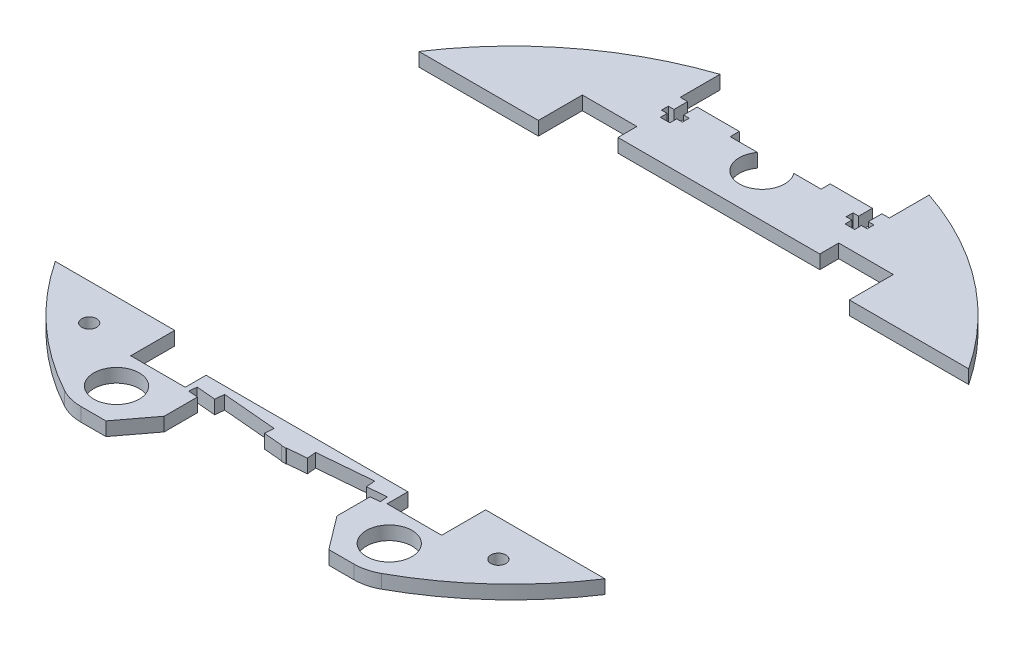
from build123d import *

# Parameters (mm, degrees)
BOSS_EXTRUDE1_DEPTH = 3
CUT_EXTRUDE1_DEPTH  = 103.574363269
SKETCH3_W           = 38.3
SKETCH3_H           = 80
CUT_EXTRUDE2_DEPTH  = 103.574363269
CUT_EXTRUDE3_DEPTH  = 95.453692358
SKETCH5_W           = 38
SKETCH5_H           = 14.605577538
CUT_EXTRUDE4_DEPTH  = 95.453692358
CUT_EXTRUDE5_DEPTH  = 95.453692358
SKETCH7_R           = 5
CUT_EXTRUDE6_DEPTH  = 92.610588908
SKETCH9_W           = 4.6
SKETCH9_H           = 1.5
CUT_EXTRUDE8_DEPTH  = 92.610588908
SKETCH10_W          = 2.1
SKETCH10_H          = 3
SKETCH10_H_2        = 1.5
CUT_EXTRUDE9_DEPTH  = 92.610588908
SKETCH11_R          = 5
CUT_EXTRUDE10_DEPTH = 92.610588908
CUT_EXTRUDE11_DEPTH = 92.610588908
SKETCH14_R          = 1.65
CUT_EXTRUDE12_DEPTH = 92.610588908


with BuildPart() as part:
    # Sketch1 → Boss-Extrude1 (new body)
    with BuildSketch(Plane(origin=(0, 0, 0), x_dir=(1, 0, 0), z_dir=(0, 1, 0))):
        with BuildLine():
            Line((-30.029977361, -64.812867647), (30.029977361, -64.812867647))
            ThreePointArc((30.029977361, -64.812867647), (32.509837414, -64.500503794), (34.834773739, -63.582926471))
            ThreePointArc((34.834773739, -63.582926471), (0, 72.5), (-34.834773739, -63.582926471))
            ThreePointArc((-34.834773739, -63.582926471), (-32.509837414, -64.500503794), (-30.029977361, -64.812867647))
        make_face()
    extrude(amount=BOSS_EXTRUDE1_DEPTH)

    # Sketch2 → Cut-Extrude1 (cut, through all)
    with BuildSketch(Plane(origin=(0, 3, 0), x_dir=(1, 0, 0), z_dir=(0, 1, 0))):
        Polygon((22.2, -45.1), (22.2, -49.675685802), (34.2, -49.675685802), (34.2, 49.675685802), (22.2, 49.675685802), (22.2, 45.5), (-22.2, 45.5), (-22.2, 49.675685802), (-34.2, 49.675685802), (-34.2, -49.675685802), (-22.2, -49.675685802), (-22.2, -45.1), align=None)
    extrude(amount=-CUT_EXTRUDE1_DEPTH, mode=Mode.SUBTRACT)

    # Sketch3 → Cut-Extrude2 (cut, through all)
    with BuildSketch(Plane(origin=(0, 3, 0), x_dir=(1, 0, 0), z_dir=(0, 1, 0))):
        with Locations((-53.35, 0)):
            Rectangle(SKETCH3_W, SKETCH3_H)
        with Locations((53.35, 0)):
            Rectangle(SKETCH3_W, SKETCH3_H)
    extrude(amount=-CUT_EXTRUDE2_DEPTH, mode=Mode.SUBTRACT)


with BuildPart() as cut_extrude2_piece_1:
    # of the separate pieces the step leaves, piece 1, a body of its own (cut_extrude2_pieces)
    add(part.part.solids().sort_by_distance((60.466933112, 0, -40))[0])

    # Sketch6 → Cut-Extrude5 (cut, through all)
    with BuildSketch(Plane(origin=(0, 3, 0), x_dir=(1, 0, 0), z_dir=(0, 1, 0))):
        Polygon((-23, 72.5), (23, 72.5), (23, 60), (10, 60), (10, 58), (-10, 58), (-10, 60), (-23, 60), align=None)
    extrude(amount=-CUT_EXTRUDE5_DEPTH, mode=Mode.SUBTRACT)

    # Sketch9 → Cut-Extrude8 (cut, through all)
    with BuildSketch(Plane(origin=(0, 3, 0), x_dir=(1, 0, 0), z_dir=(0, 1, 0))):
        with Locations((20.32, 56.25)):
            Rectangle(SKETCH9_W, SKETCH9_H)
        with Locations((-20.32, 56.25)):
            Rectangle(SKETCH9_W, SKETCH9_H)
    extrude(amount=-CUT_EXTRUDE8_DEPTH, mode=Mode.SUBTRACT)

    # Sketch10 → Cut-Extrude9 (cut, through all)
    with BuildSketch(Plane(origin=(0, 3, 0), x_dir=(1, 0, 0), z_dir=(0, 1, 0))):
        with Locations((20.32, 58.5)):
            Rectangle(SKETCH10_W, SKETCH10_H)
        with Locations((20.32, 54.75)):
            Rectangle(SKETCH10_W, SKETCH10_H_2)
        with Locations((-20.32, 54.75)):
            Rectangle(SKETCH10_W, SKETCH10_H_2)
        with Locations((-20.32, 58.5)):
            Rectangle(SKETCH10_W, SKETCH10_H)
    extrude(amount=-CUT_EXTRUDE9_DEPTH, mode=Mode.SUBTRACT)

    # Sketch11 → Cut-Extrude10 (cut, through all)
    with BuildSketch(Plane(origin=(0, 3, 0), x_dir=(1, 0, 0), z_dir=(0, 1, 0))):
        with Locations((0, 55)):
            Circle(SKETCH11_R)
    extrude(amount=-CUT_EXTRUDE10_DEPTH, mode=Mode.SUBTRACT)


with BuildPart() as cut_extrude2_piece_2:
    # of the separate pieces the step leaves, piece 2, a body of its own (cut_extrude2_pieces)
    add(part.part.solids().sort_by_distance((-34.834773739, 0, 63.582926471))[0])

    # Sketch4 → Cut-Extrude3 (cut, through all)
    with BuildSketch(Plane(origin=(0, 3, 0), x_dir=(1, 0, 0), z_dir=(0, 1, 0))):
        Polygon((-21.070156074, -50.026174921), (-0.648164763, -51.812867647), (-0.5, -50.11933666), (-20.921991311, -48.332643934), align=None)
        Polygon((21.070156074, -50.026174921), (20.921991311, -48.332643934), (0.5, -50.11933666), (0.648164763, -51.812867647), align=None)
    extrude(amount=-CUT_EXTRUDE3_DEPTH, mode=Mode.SUBTRACT)

    # Sketch5 → Cut-Extrude4 (cut, through all)
    with BuildSketch(Plane(origin=(0, 3, 0), x_dir=(1, 0, 0), z_dir=(0, 1, 0))):
        with Locations((0, -57.510078878)):
            Rectangle(SKETCH5_W, SKETCH5_H)
        Polygon((16.688163844, -48.703055841), (4.733827467, -49.748924754), (4.559515981, -47.756535357), (16.513852358, -46.710666444), align=None)
        Polygon((-16.513852358, -46.710666444), (-4.559515981, -47.756535357), (-4.733827467, -49.748924754), (-16.688163844, -48.703055841), align=None)
    extrude(amount=-CUT_EXTRUDE4_DEPTH, mode=Mode.SUBTRACT)

    # Sketch7 → Cut-Extrude6 (cut, through all)
    with BuildSketch(Plane(origin=(0, 3, 0), x_dir=(1, 0, 0), z_dir=(0, 1, 0))):
        with Locations((-30, -57)):
            Circle(SKETCH7_R)
        with Locations((30, -57)):
            Circle(SKETCH7_R)
    extrude(amount=-CUT_EXTRUDE6_DEPTH, mode=Mode.SUBTRACT)

    # Sketch13 → Cut-Extrude11 (cut, through all)
    with BuildSketch(Plane(origin=(0, 3, 0), x_dir=(1, 0, 0), z_dir=(0, 1, 0))):
        Polygon((19, -57.510078878), (24.514988681, -64.812867647), (19, -64.812867647), align=None)
        Polygon((-19, -64.812867647), (-19, -57.510078878), (-24.514988681, -64.812867647), align=None)
    extrude(amount=-CUT_EXTRUDE11_DEPTH, mode=Mode.SUBTRACT)

    # Sketch14 → Cut-Extrude12 (cut, through all)
    with BuildSketch(Plane(origin=(0, 3, 0), x_dir=(1, 0, 0), z_dir=(0, 1, 0))):
        with Locations((45, -48)):
            Circle(SKETCH14_R)
        with Locations((-45, -48)):
            Circle(SKETCH14_R)
    extrude(amount=-CUT_EXTRUDE12_DEPTH, mode=Mode.SUBTRACT)


solid = Compound([cut_extrude2_piece_1.part, cut_extrude2_piece_2.part])
